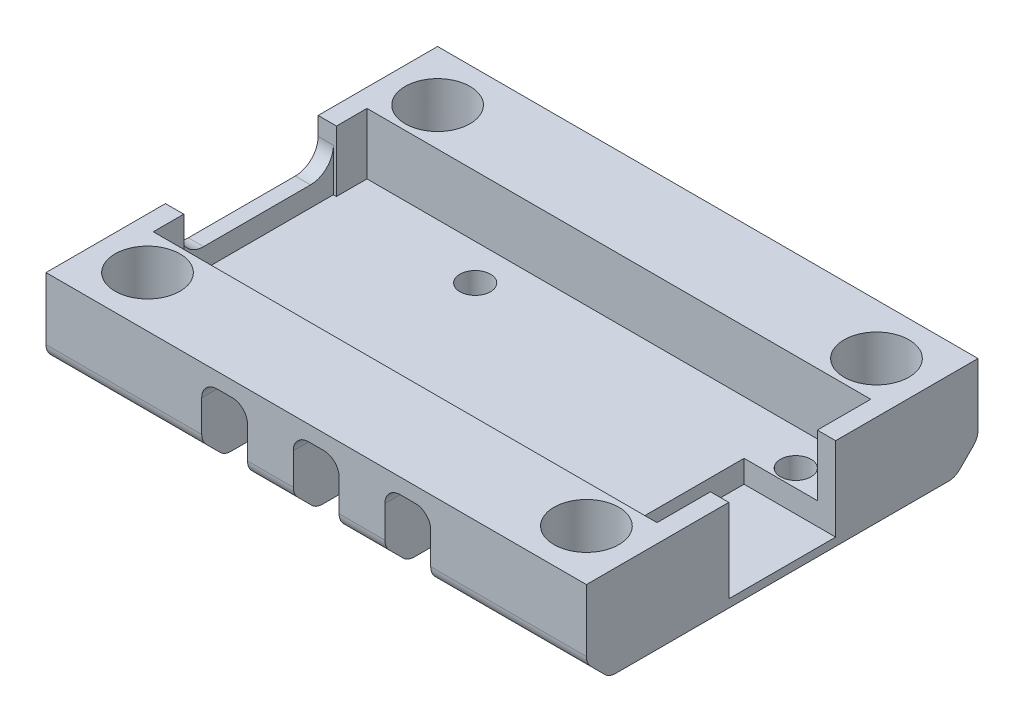
from build123d import *

# Parameters (mm, degrees)
SKETCH1_W           = 35.4
SKETCH1_H           = 25.65
SKETCH1_R           = 2.125
BOSS_EXTRUDE1_DEPTH = 2
SKETCH1_3_R         = 2.125
BOSS_EXTRUDE2_DEPTH = 6
SKETCH2_W           = 3
SKETCH2_H           = 4.5
CUT_EXTRUDE1_DEPTH  = 5
CHAMFER1_SIZE       = 1.5
FILLET1_R           = 1
SKETCH3_W           = 7
SKETCH3_H           = 5.470677448
CUT_EXTRUDE2_DEPTH  = 6
SKETCH4_R           = 1
CUT_EXTRUDE3_DEPTH  = 2
SKETCH5_W           = 10
SKETCH5_H           = 1.310302081
BOSS_EXTRUDE3_DEPTH = 1
FILLET2_R           = 1.5


with BuildPart() as part:
    # Sketch1 → Boss-Extrude1 (new body)
    with BuildSketch(Plane(origin=(0, 0, 0), x_dir=(1, 0, 0), z_dir=(0, 1, 0))):
        with Locations((16.5, 7)):
            Rectangle(SKETCH1_W, SKETCH1_H)
        with Locations(Location((30.875, -2.5, 0), (0, 0, 270))):
            Circle(SKETCH1_R, mode=Mode.SUBTRACT)
        with Locations(Location((2.125, -2.5, 0), (0, 0, 270))):
            Circle(SKETCH1_R, mode=Mode.SUBTRACT)
        with Locations(Location((2.125, 16.5, 0), (0, 0, 270))):
            Circle(SKETCH1_R, mode=Mode.SUBTRACT)
        with Locations(Location((30.875, 16.5, 0), (0, 0, 270))):
            Circle(SKETCH1_R, mode=Mode.SUBTRACT)
    extrude(amount=BOSS_EXTRUDE1_DEPTH)

    # Sketch1<3> → Boss-Extrude2 (add)
    # profile 1 of 2: a face of its own
    with BuildSketch(Plane(origin=(0, 0, 0), x_dir=(1, 0, 0), z_dir=(0, 1, 0))):
        Polygon((33, 0), (0, 0), (0, 2), (-1.2, 2), (-1.2, -5.825), (34.2, -5.825), (34.2, 3.5), (33, 3.5), align=None)
        with Locations(Location((2.125, -2.5, 0), (0, 0, 270))):
            Circle(SKETCH1_3_R, mode=Mode.SUBTRACT)
        with Locations(Location((30.875, -2.5, 0), (0, 0, 270))):
            Circle(SKETCH1_3_R, mode=Mode.SUBTRACT)
    # profile 2 of 2: a face of its own
    with BuildSketch(Plane(origin=(0, 0, 0), x_dir=(1, 0, 0), z_dir=(0, 1, 0))):
        Polygon((-1.2, 12), (0, 12), (0, 14), (33, 14), (33, 10.5), (34.2, 10.5), (34.2, 19.825), (-1.2, 19.825), align=None)
        with Locations(Location((2.125, 16.5, 0), (0, 0, 270))):
            Circle(SKETCH1_3_R, mode=Mode.SUBTRACT)
        with Locations(Location((30.875, 16.5, 0), (0, 0, 270))):
            Circle(SKETCH1_3_R, mode=Mode.SUBTRACT)
    extrude(amount=BOSS_EXTRUDE2_DEPTH)

    # Sketch2 → Cut-Extrude1 (cut)
    with BuildSketch(Plane(origin=(0, 0, 0), x_dir=(-1, 0, 0), z_dir=(0, -1, 0))):
        with Locations((-10.5, -3.575)):
            Rectangle(SKETCH2_W, SKETCH2_H)
        with Locations((-16.5, -3.575)):
            Rectangle(SKETCH2_W, SKETCH2_H)
        with Locations((-22.5, -3.575)):
            Rectangle(SKETCH2_W, SKETCH2_H)
        with Locations((-22.5, 17.575)):
            Rectangle(SKETCH2_W, SKETCH2_H)
        with Locations((-16.5, 17.575)):
            Rectangle(SKETCH2_W, SKETCH2_H)
        with Locations((-10.5, 17.575)):
            Rectangle(SKETCH2_W, SKETCH2_H)
    extrude(amount=-CUT_EXTRUDE1_DEPTH, mode=Mode.SUBTRACT)

    # Chamfer1
    # the kernel refuses this chamfer: 1.5 mm, written as the material it adds along each edge
    with BuildSketch(Plane(origin=(5.142475518, 5, -15.325), x_dir=(0, -0.9996219169112968, 0.027495876610586775), z_dir=(1, 0, 0)), Plane(origin=(11.142475518, 5, -15.325), x_dir=(0, -0.9996219169112968, 0.027495876610586775), z_dir=(1, 0, 0)), Plane(origin=(17.142475518, 5, -15.325), x_dir=(0, -0.9996219169112968, 0.027495876610586775), z_dir=(1, 0, 0)), Plane(origin=(5.142475518, 5, 1.325), x_dir=(0, 0.0274958766105862, 0.9996219169112968), z_dir=(1, 0, 0))) as chamfer1_piece_1:
        Polygon((CHAMFER1_SIZE * 0.999621916911, CHAMFER1_SIZE * 0.0274958766106), (-CHAMFER1_SIZE * 0.0274958766106, CHAMFER1_SIZE * 0.999621916911), (0, 0), align=None)
    extrude(amount=10.715048964)
    with BuildSketch(Plane(origin=(27.857524482, 5, 1.325), x_dir=(0, 0.0274958766105862, 0.9996219169112968), z_dir=(-1, 0, 0)), Plane(origin=(21.857524482, 5, 1.325), x_dir=(0, 0.0274958766105862, 0.9996219169112968), z_dir=(-1, 0, 0))) as chamfer1_piece_2:
        Polygon((CHAMFER1_SIZE * 0.999621916911, -CHAMFER1_SIZE * 0.0274958766106), (-CHAMFER1_SIZE * 0.0274958766106, -CHAMFER1_SIZE * 0.999621916911), (0, 0), align=None)
    extrude(amount=10.715048964)
    # the kernel refuses this chamfer: 1.5 mm, written as the material it takes off along each edge
    with BuildSketch(Plane(origin=(18.857524482, 0, -19.825), x_dir=(0, 0.9996219169112968, -0.027495876610586778), z_dir=(-1, 0, 0)), Plane(origin=(24.857524482, 0, -19.825), x_dir=(0, 0.9996219169112968, -0.027495876610586778), z_dir=(-1, 0, 0)), Plane(origin=(8.142475518, 0, 5.825), x_dir=(0, 0.9996219169112968, 0.027495876610586202), z_dir=(1, 0, 0)), Plane(origin=(14.142475518, 0, 5.825), x_dir=(0, 0.9996219169112968, 0.027495876610586202), z_dir=(1, 0, 0))) as chamfer1_2_piece_1:
        Polygon((CHAMFER1_SIZE * 0.999621916911, -CHAMFER1_SIZE * 0.0274958766106), (-CHAMFER1_SIZE * 0.0274958766106, -CHAMFER1_SIZE * 0.999621916911), (0, 0), align=None)
    extrude(amount=10.715048964, mode=Mode.SUBTRACT)
    with BuildSketch(Plane(origin=(38.057524482, 0, -19.825), x_dir=(0, 0.9996219169112968, -0.027495876610586778), z_dir=(-1, 0, 0)), Plane(origin=(20.142475518, 0, 5.825), x_dir=(0, 0.9996219169112968, 0.027495876610586202), z_dir=(1, 0, 0)), Plane(origin=(-5.057524482, 0, 5.825), x_dir=(0, 0.9996219169112968, 0.027495876610586202), z_dir=(1, 0, 0)), Plane(origin=(12.857524482, 0, -19.825), x_dir=(0, 0.9996219169112968, -0.027495876610586778), z_dir=(-1, 0, 0))) as chamfer1_2_piece_2:
        Polygon((CHAMFER1_SIZE * 0.999621916911, -CHAMFER1_SIZE * 0.0274958766106), (-CHAMFER1_SIZE * 0.0274958766106, -CHAMFER1_SIZE * 0.999621916911), (0, 0), align=None)
    extrude(amount=17.915048964, mode=Mode.SUBTRACT)

    # Fillet1
    # the kernel refuses this fillet: 1 mm, written as the material it adds along each edge
    with BuildSketch(Plane(origin=(21, 0, -15.325), x_dir=(0, 0, -1), z_dir=(0, 1, 0)), Plane(origin=(15, 0, -15.325), x_dir=(0, 0, -1), z_dir=(0, 1, 0)), Plane(origin=(12, 0, -15.325), x_dir=(-1, 0, 0), z_dir=(0, 1, 0)), Plane(origin=(24, 0, -15.325), x_dir=(-1, 0, 0), z_dir=(0, 1, 0)), Plane(origin=(18, 0, -15.325), x_dir=(-1, 0, 0), z_dir=(0, 1, 0)), Plane(origin=(12, 0, 1.325), x_dir=(0, 0, 1), z_dir=(0, 1, 0)), Plane(origin=(18, 0, 1.325), x_dir=(0, 0, 1), z_dir=(0, 1, 0)), Plane(origin=(9, 0, 1.325), x_dir=(1, 0, 0), z_dir=(0, 1, 0)), Plane(origin=(15, 0, 1.325), x_dir=(1, 0, 0), z_dir=(0, 1, 0)), Plane(origin=(21, 0, 1.325), x_dir=(1, 0, 0), z_dir=(0, 1, 0))) as fillet1_piece_1:
        with BuildLine():
            CenterArc((FILLET1_R, -FILLET1_R), FILLET1_R, 90, 90)
            Line((0, -FILLET1_R), (0, 0))
            Line((0, 0), (FILLET1_R, 0))
        make_face()
    extrude(amount=6)
    with BuildSketch(Plane(origin=(21, 5, -19.825), x_dir=(1, 0, 0), z_dir=(0, 0, 1)), Plane(origin=(15, 5, -19.825), x_dir=(1, 0, 0), z_dir=(0, 0, 1)), Plane(origin=(9, 5, -19.825), x_dir=(1, 0, 0), z_dir=(0, 0, 1)), Plane(origin=(12, 5, -14.325), x_dir=(-1, 0, 0), z_dir=(0, 0, -1)), Plane(origin=(24, 5, -14.325), x_dir=(-1, 0, 0), z_dir=(0, 0, -1)), Plane(origin=(18, 5, -14.325), x_dir=(-1, 0, 0), z_dir=(0, 0, -1)), Plane(origin=(15, 5, 0.325), x_dir=(1, 0, 0), z_dir=(0, 0, 1)), Plane(origin=(24, 5, 5.825), x_dir=(-1, 0, 0), z_dir=(0, 0, -1)), Plane(origin=(18, 5, 5.825), x_dir=(-1, 0, 0), z_dir=(0, 0, -1))) as fillet1_piece_2:
        with BuildLine():
            CenterArc((FILLET1_R, -FILLET1_R), FILLET1_R, 90, 90)
            Line((0, -FILLET1_R), (0, 0))
            Line((0, 0), (FILLET1_R, 0))
        make_face()
    extrude(amount=5.5)
    with BuildSketch(Plane(origin=(9, 0, -15.325), x_dir=(1, 0, 0), z_dir=(0, 1, 0)), Plane(origin=(24, 0, 1.325), x_dir=(-1, 0, 0), z_dir=(0, 1, 0))) as fillet1_piece_3:
        with BuildLine():
            CenterArc((FILLET1_R, FILLET1_R), FILLET1_R, 180, 90)
            Line((0, FILLET1_R), (0, 0))
            Line((0, 0), (FILLET1_R, 0))
        make_face()
    extrude(amount=6)
    with BuildSketch(Plane(origin=(21, 5, 0.325), x_dir=(0, -1, 0), z_dir=(0, 0, 1)), Plane(origin=(9, 5, 5.825), x_dir=(1, 0, 0), z_dir=(0, 0, -1)), Plane(origin=(12, 5, 0.325), x_dir=(-1, 0, 0), z_dir=(0, 0, 1))) as fillet1_piece_4:
        with BuildLine():
            CenterArc((FILLET1_R, FILLET1_R), FILLET1_R, 180, 90)
            Line((0, FILLET1_R), (0, 0))
            Line((0, 0), (FILLET1_R, 0))
        make_face()
    extrude(amount=5.5)
    # the kernel refuses this fillet: 1 mm, written as the material it takes off along each edge
    with BuildSketch(Plane(origin=(35.235533906, 0, -18.325), x_dir=(0, 0, 1), z_dir=(-1, 0, 0)), Plane(origin=(2.071956853, 0, -18.325), x_dir=(0, 0, 1), z_dir=(-1, 0, 0)), Plane(origin=(-2.235533906, 0, 4.325), x_dir=(0, 0, -1), z_dir=(1, 0, 0)), Plane(origin=(30.928043147, 0, 4.325), x_dir=(0, 0, -1), z_dir=(1, 0, 0))) as fillet1_2_piece_1:
        with BuildLine():
            CenterArc((FILLET1_R * 0.414213562373, FILLET1_R), FILLET1_R, 225, 45)
            Line((-FILLET1_R * 0.292893218813, FILLET1_R * 0.292893218813), (0, 0))
            Line((0, 0), (FILLET1_R * 0.414213562373, 0))
        make_face()
    extrude(amount=4.307490759, mode=Mode.SUBTRACT)
    with BuildSketch(Plane(origin=(22.964466094, 1.5, -19.825), x_dir=(0, -0.7071067811862655, 0.7071067811868295), z_dir=(1, 0, 0)), Plane(origin=(-2.235533906, 1.5, -19.825), x_dir=(0, -0.7071067811862655, 0.7071067811868295), z_dir=(1, 0, 0))) as fillet1_2_piece_2:
        with BuildLine():
            CenterArc((FILLET1_R * 0.414213562373, -FILLET1_R), FILLET1_R, 90, 45)
            Line((-FILLET1_R * 0.292893218814, -FILLET1_R * 0.292893218814), (0, 0))
            Line((0, 0), (FILLET1_R * 0.414213562373, 0))
        make_face()
    extrude(amount=12.271067812, mode=Mode.SUBTRACT)
    with BuildSketch(Plane(origin=(22.964466094, 0, -18.325), x_dir=(0, 0, 1), z_dir=(1, 0, 0)), Plane(origin=(2.178043147, 0, -18.325), x_dir=(0, 0, 1), z_dir=(1, 0, 0)), Plane(origin=(10.035533906, 0, 4.325), x_dir=(0, 0, -1), z_dir=(-1, 0, 0)), Plane(origin=(30.821956853, 0, 4.325), x_dir=(0, 0, -1), z_dir=(-1, 0, 0))) as fillet1_2_piece_3:
        with BuildLine():
            CenterArc((FILLET1_R * 0.414213562373, -FILLET1_R), FILLET1_R, 90, 45)
            Line((-FILLET1_R * 0.292893218813, -FILLET1_R * 0.292893218813), (0, 0))
            Line((0, 0), (FILLET1_R * 0.414213562373, 0))
        make_face()
    extrude(amount=7.857490759, mode=Mode.SUBTRACT)
    with BuildSketch(Plane(origin=(16.964466094, 1.5, -19.825), x_dir=(0, -0.7071067811862655, 0.7071067811868295), z_dir=(1, 0, 0)), Plane(origin=(16.964466094, 0, -18.325), x_dir=(0, 0, 1), z_dir=(1, 0, 0)), Plane(origin=(10.964466094, 1.5, -19.825), x_dir=(0, -0.7071067811862655, 0.7071067811868295), z_dir=(1, 0, 0)), Plane(origin=(10.964466094, 0, -18.325), x_dir=(0, 0, 1), z_dir=(1, 0, 0)), Plane(origin=(16.035533906, 0, 4.325), x_dir=(0, 0, -1), z_dir=(-1, 0, 0)), Plane(origin=(22.035533906, 0, 4.325), x_dir=(0, 0, -1), z_dir=(-1, 0, 0))) as fillet1_2_piece_4:
        with BuildLine():
            CenterArc((FILLET1_R * 0.414213562373, -FILLET1_R), FILLET1_R, 90, 45)
            Line((-FILLET1_R * 0.292893218814, -FILLET1_R * 0.292893218814), (0, 0))
            Line((0, 0), (FILLET1_R * 0.414213562373, 0))
        make_face()
    extrude(amount=5.071067812, mode=Mode.SUBTRACT)
    with BuildSketch(Plane(origin=(-2.235533906, 1.5, 5.825), x_dir=(0, -0.707106781186265, -0.70710678118683), z_dir=(1, 0, 0)), Plane(origin=(22.964466094, 1.5, 5.825), x_dir=(0, -0.707106781186265, -0.70710678118683), z_dir=(1, 0, 0))) as fillet1_2_piece_5:
        with BuildLine():
            CenterArc((FILLET1_R * 0.414213562373, FILLET1_R), FILLET1_R, 225, 45)
            Line((-FILLET1_R * 0.292893218814, FILLET1_R * 0.292893218814), (0, 0))
            Line((0, 0), (FILLET1_R * 0.414213562373, 0))
        make_face()
    extrude(amount=12.271067812, mode=Mode.SUBTRACT)
    with BuildSketch(Plane(origin=(10.964466094, 1.5, 5.825), x_dir=(0, -0.7071067811862647, -0.7071067811868302), z_dir=(1, 0, 0)), Plane(origin=(16.964466094, 1.5, 5.825), x_dir=(0, -0.7071067811862652, -0.7071067811868297), z_dir=(1, 0, 0))) as fillet1_2_piece_6:
        with BuildLine():
            CenterArc((FILLET1_R * 0.414213562373, FILLET1_R), FILLET1_R, 225, 45)
            Line((-FILLET1_R * 0.292893218814, FILLET1_R * 0.292893218814), (0, 0))
            Line((0, 0), (FILLET1_R * 0.414213562373, 0))
        make_face()
    extrude(amount=5.071067812, mode=Mode.SUBTRACT)

    # Sketch3 → Cut-Extrude2 (cut)
    with BuildSketch(Plane(origin=(34.2, 0, 0), x_dir=(0, 0, -1), z_dir=(1, 0, 0))):
        with Locations((7, 3.264661276)):
            Rectangle(SKETCH3_W, SKETCH3_H)
    extrude(amount=-CUT_EXTRUDE2_DEPTH, mode=Mode.SUBTRACT)

    # Sketch4 → Cut-Extrude3 (cut)
    with BuildSketch(Plane(origin=(0, 2, 0), x_dir=(1, 0, 0), z_dir=(0, 1, 0))):
        with Locations(Location((9.446942501, 11.641698117, 0), (0, 0, 270))):
            Circle(SKETCH4_R)
        with Locations(Location((30.446985681, 11.641698117, 0), (0, 0, 270))):
            Circle(SKETCH4_R)
        with Locations(Location((30.446985681, 2.141677797, 0), (0, 0, 270))):
            Circle(SKETCH4_R)
    extrude(amount=-CUT_EXTRUDE3_DEPTH, mode=Mode.SUBTRACT)

    # Sketch5 → Boss-Extrude3 (add)
    with BuildSketch(Plane.ZY.offset(1.2)):
        with Locations((-7, 2.65515104)):
            Rectangle(SKETCH5_W, SKETCH5_H)
    extrude(amount=-BOSS_EXTRUDE3_DEPTH)

    # Fillet2
    fillet2_edges = [part.edges().sort_by_distance(p)[0] for p in [
        (-0.7, 3.310302081, -12),
        (-0.7, 3.310302081, -2),
    ]]
    fillet(fillet2_edges, radius=FILLET2_R)


solid = part.part
